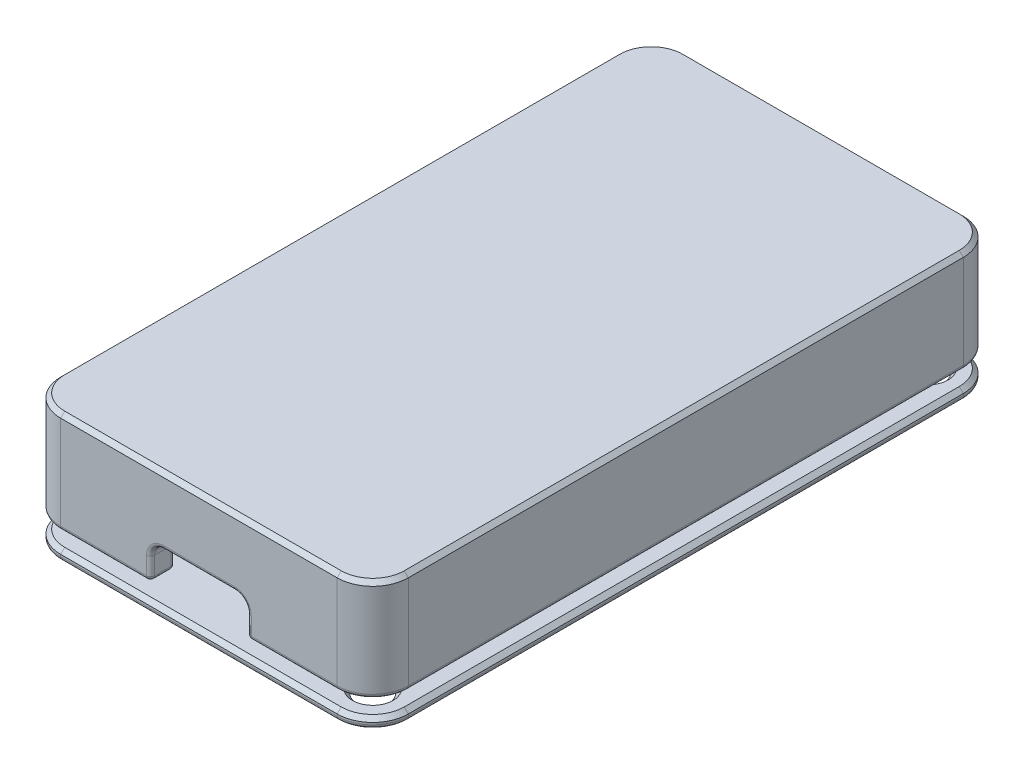
from build123d import *

# Parameters (mm, degrees)
BOSS_EXTRUDE1_DEPTH = 1
SKETCH2_W           = 29.4
SKETCH2_H           = 56.8
BOSS_EXTRUDE2_DEPTH = 9
BOSS_EXTRUDE3_START = -10
BOSS_EXTRUDE3_DEPTH = 1.6
BOSS_EXTRUDE5_DEPTH = 8.4
BOSS_EXTRUDE4_START = 8.4
SKETCH4_W           = 3.6
SKETCH4_H           = 3.6
BOSS_EXTRUDE4_DEPTH = 1
CUT_EXTRUDE1_DEPTH  = 10
SKETCH7_R           = 2
CUT_EXTRUDE2_DEPTH  = 6.7
SKETCH8_R           = 1.6
CUT_EXTRUDE4_DEPTH  = 37.620349534
CHAMFER1_SIZE       = 0.4
CHAMFER2_SIZE       = 0.4
FILLET1_R           = 0.4
FILLET2_R           = 0.4


# Read off the part's stored shape, not the designer's step: Boss-Extrude5
with BuildPart() as part:
    # Sketch1 → Boss-Extrude1 (new body)
    with BuildSketch(Plane(origin=(0, 0, 0), x_dir=(1, 0, 0), z_dir=(0, 1, 0))):
        with BuildLine():
            Line((14.7, 28.4), (14.7, -28.4))
            Line((14.7, -28.4), (-14.7, -28.4))
            Line((-14.7, -28.4), (-14.7, 28.4))
            Line((-14.7, 28.4), (-6.8, 28.4))
            Line((-6.8, 28.4), (-6.8, 30.8))
            Line((-6.8, 30.8), (-13.6, 30.8))
            ThreePointArc((-13.6, 30.8), (-16.074873734, 29.774873734), (-17.1, 27.3))
            Line((-17.1, 27.3), (-17.1, -27.3))
            ThreePointArc((-17.1, -27.3), (-16.074873734, -29.774873734), (-13.6, -30.8))
            Line((-13.6, -30.8), (13.6, -30.8))
            ThreePointArc((13.6, -30.8), (16.074873734, -29.774873734), (17.1, -27.3))
            Line((17.1, -27.3), (17.1, 27.3))
            ThreePointArc((17.1, 27.3), (16.074873734, 29.774873734), (13.6, 30.8))
            Line((13.6, 30.8), (6.8, 30.8))
            Line((6.8, 30.8), (6.8, 28.4))
            Line((6.8, 28.4), (14.7, 28.4))
        make_face()
    extrude(amount=BOSS_EXTRUDE1_DEPTH)

    # Sketch2 → Boss-Extrude2 (add)
    with BuildSketch(Plane(origin=(0, 1, 0), x_dir=(1, 0, 0), z_dir=(0, 1, 0))):
        with BuildLine():
            ThreePointArc((-13.6, 30.8), (-16.074873734, 29.774873734), (-17.1, 27.3))
            Line((-17.1, 27.3), (-17.1, -27.3))
            ThreePointArc((-17.1, -27.3), (-16.074873734, -29.774873734), (-13.6, -30.8))
            Line((-13.6, -30.8), (13.6, -30.8))
            ThreePointArc((13.6, -30.8), (16.074873734, -29.774873734), (17.1, -27.3))
            Line((17.1, -27.3), (17.1, 27.3))
            ThreePointArc((17.1, 27.3), (16.074873734, 29.774873734), (13.6, 30.8))
            Line((13.6, 30.8), (-13.6, 30.8))
        make_face()
        Rectangle(SKETCH2_W, SKETCH2_H, mode=Mode.SUBTRACT)
    extrude(amount=BOSS_EXTRUDE2_DEPTH)

    # Sketch3 → Boss-Extrude3 (add)
    with BuildSketch(Plane.XZ.offset(BOSS_EXTRUDE3_START)):
        with BuildLine():
            Line((13.6, 30.8), (-13.6, 30.8))
            ThreePointArc((-13.6, 30.8), (-16.074873734, 29.774873734), (-17.1, 27.3))
            Line((-17.1, 27.3), (-17.1, -27.3))
            ThreePointArc((-17.1, -27.3), (-16.074873734, -29.774873734), (-13.6, -30.8))
            Line((-13.6, -30.8), (13.6, -30.8))
            ThreePointArc((13.6, -30.8), (16.074873734, -29.774873734), (17.1, -27.3))
            Line((17.1, -27.3), (17.1, 27.3))
            ThreePointArc((17.1, 27.3), (16.074873734, 29.774873734), (13.6, 30.8))
        make_face()
    extrude(amount=BOSS_EXTRUDE3_DEPTH)

    # Boss-Extrude5 outline → Boss-Extrude5 (add)
    with BuildSketch(Plane.XZ.offset(-8.4)):
        with BuildLine():
            ThreePointArc((-13.6, -3.6), (-10, 0), (-13.6, 3.6))
            Line((-13.6, 3.6), (-14.7, 3.6))
            Line((-14.7, 3.6), (-14.7, -3.6))
            Line((-14.7, -3.6), (-13.6, -3.6))
        make_face()
        with BuildLine():
            Line((14.7, 28.4), (10, 28.4))
            Line((10, 28.4), (10, 27.3))
            ThreePointArc((10, 27.3), (11.054415588, 24.754415588), (13.6, 23.7))
            Line((13.6, 23.7), (14.7, 23.7))
            Line((14.7, 23.7), (14.7, 28.4))
        make_face()
        with BuildLine():
            Line((10, -27.3), (10, -28.4))
            Line((10, -28.4), (14.7, -28.4))
            Line((14.7, -28.4), (14.7, -23.7))
            Line((14.7, -23.7), (13.6, -23.7))
            ThreePointArc((13.6, -23.7), (11.054415588, -24.754415588), (10, -27.3))
        make_face()
    extrude(amount=BOSS_EXTRUDE5_DEPTH)

    # Sketch5 → Cut-Extrude1 (cut)
    with BuildSketch(Plane.XY.offset(30.8)):
        with BuildLine():
            Line((-3.5, 3.4), (3.5, 3.4))
            ThreePointArc((3.5, 3.4), (4.383883476, 3.033883476), (4.75, 2.15))
            Line((4.75, 2.15), (4.75, 0))
            Line((4.75, 0), (-4.75, 0))
            Line((-4.75, 0), (-4.75, 2.15))
            ThreePointArc((-4.75, 2.15), (-4.383883476, 3.033883476), (-3.5, 3.4))
        make_face()
    extrude(amount=-CUT_EXTRUDE1_DEPTH, mode=Mode.SUBTRACT)

    # Sketch7 → Cut-Extrude2 (cut)
    with BuildSketch(Plane.XZ):
        with Locations(Location((-13.6, 0, 0), (0, 0, 270))):
            Circle(SKETCH7_R)
        with Locations(Location((13.6, -27.3, 0), (0, 0, 270))):
            Circle(SKETCH7_R)
        with Locations(Location((13.6, 27.3, 0), (0, 0, 270))):
            Circle(SKETCH7_R)
    extrude(amount=-CUT_EXTRUDE2_DEPTH, mode=Mode.SUBTRACT)

    # Chamfer1
    chamfer1_edges = [part.edges().sort_by_distance(p)[0] for p in [
        (0, 10, 30.8),
        (16.074873734, 10, 29.774873734),
        (17.1, 10, 0),
        (16.074873734, 10, -29.774873734),
        (0, 10, -30.8),
        (-16.074873734, 10, -29.774873734),
        (-17.1, 10, 0),
        (-16.074873734, 10, 29.774873734),
    ]]
    chamfer(chamfer1_edges, length=CHAMFER1_SIZE)

    # Fillet2
    fillet2_edges = [part.edges().sort_by_distance(p)[0] for p in [
        (-14.7, 4.2, -28.4),
        (-14.7, 4.2, 28.4),
        (-2.35, 8.4, 28.4),
        (-14.7, 8.4, 16),
        (-2.35, 8.4, -28.4),
        (-14.7, 8.4, -16),
        (-14.7, 0, -16),
        (-10, 0, 0),
        (-10, 8.4, 0),
        (-14.15, 0, 3.6),
        (-14.15, 8.4, 3.6),
        (-14.7, 4.2, 3.6),
        (-14.7, 4.2, -3.6),
        (-14.15, 8.4, -3.6),
        (-14.15, 0, -3.6),
        (14.7, 0, 0),
        (14.7, 8.4, 0),
        (10, 8.4, 27.85),
        (14.7, 4.2, 23.7),
        (14.15, 0, 23.7),
        (14.15, 8.4, 23.7),
        (11.054415588, 0, 24.754415588),
        (11.054415588, 8.4, 24.754415588),
        (10, 4.2, 28.4),
        (10, 0, 27.85),
        (-9.175, 0, 30.8),
        (14.15, 8.4, -23.7),
        (10, 4.2, -28.4),
        (10, 0, -27.85),
        (10, 8.4, -27.85),
        (11.054415588, 0, -24.754415588),
        (11.054415588, 8.4, -24.754415588),
        (-16.074873734, 0, 29.774873734),
        (14.7, 4.2, -23.7),
        (14.15, 0, -23.7),
        (-17.1, 0, 0),
        (-16.074873734, 0, -29.774873734),
        (9.175, 0, 30.8),
        (7.375, 0, 28.4),
        (-4.75, 0, 29.6),
        (-10.2, 0, -30.8),
        (4.75, 0, 29.6),
        (-6.8, 0, -29.6),
        (-4.383883476, 3.033883476, 28.4),
        (0, 3.4, 28.4),
        (4.383883476, 3.033883476, 28.4),
        (4.75, 1.075, 28.4),
        (-4.75, 1.075, 28.4),
        (4.75, 1.075, 30.8),
        (-10.75, 0, -28.4),
        (4.383883476, 3.033883476, 30.8),
        (0, 3.4, 30.8),
        (-4.383883476, 3.033883476, 30.8),
        (-4.75, 1.075, 30.8),
        (-14.7, 0, 16),
        (-9.725, 0, 28.4),
        (8.4, 0, -28.4),
        (-13.6, 0, 2),
        (13.6, 0, -25.3),
        (13.6, 0, 29.3),
        (6.8, 0, -29.6),
        (10.2, 0, -30.8),
        (16.074873734, 0, -29.774873734),
        (17.1, 0, 0),
        (16.074873734, 0, 29.774873734),
        (-6.8, 0.5, -30.8),
        (-6.8, 0.5, -28.4),
        (6.8, 0.5, -28.4),
        (6.8, 0.5, -30.8),
        (0, 1, -28.4),
        (0, 1, -30.8),
    ]]
    fillet(fillet2_edges, radius=FILLET2_R)


with BuildPart() as body_2:
    # Sketch4 → Boss-Extrude4 (new body)
    # profile 1 of 2: a face of its own
    with BuildSketch(Plane.XZ.offset(-8.4).offset(BOSS_EXTRUDE4_START)):
        with BuildLine():
            Line((-13.6, -30.8), (13.6, -30.8))
            ThreePointArc((13.6, -30.8), (16.074873734, -29.774873734), (17.1, -27.3))
            Line((17.1, -27.3), (17.1, 27.3))
            ThreePointArc((17.1, 27.3), (16.074873734, 29.774873734), (13.6, 30.8))
            Line((13.6, 30.8), (-13.6, 30.8))
            ThreePointArc((-13.6, 30.8), (-16.074873734, 29.774873734), (-17.1, 27.3))
            Line((-17.1, 27.3), (-17.1, -27.3))
            ThreePointArc((-17.1, -27.3), (-16.074873734, -29.774873734), (-13.6, -30.8))
        make_face()
        with BuildLine():
            Line((10, -28.4), (10, -27.3))
            ThreePointArc((10, -27.3), (11.054415588, -24.754415588), (13.6, -23.7))
            Line((13.6, -23.7), (14.7, -23.7))
            Line((14.7, -23.7), (14.7, 23.7))
            Line((14.7, 23.7), (13.6, 23.7))
            ThreePointArc((13.6, 23.7), (11.054415588, 24.754415588), (10, 27.3))
            Line((10, 27.3), (10, 28.4))
            Line((10, 28.4), (-14.7, 28.4))
            Line((-14.7, 28.4), (-14.7, 3.6))
            Line((-14.7, 3.6), (-13.6, 3.6))
            ThreePointArc((-13.6, 3.6), (-10, 0), (-13.6, -3.6))
            Line((-13.6, -3.6), (-14.7, -3.6))
            Line((-14.7, -3.6), (-14.7, -28.4))
            Line((-14.7, -28.4), (10, -28.4))
        make_face(mode=Mode.SUBTRACT)
    # profile 2 of 2: a face of its own
    with BuildSketch(Plane.XZ.offset(-8.4).offset(BOSS_EXTRUDE4_START)):
        with BuildLine():
            Line((-14.7, -28.4), (10, -28.4))
            Line((10, -28.4), (10, -27.3))
            ThreePointArc((10, -27.3), (11.054415588, -24.754415588), (13.6, -23.7))
            Line((13.6, -23.7), (14.7, -23.7))
            Line((14.7, -23.7), (14.7, 23.7))
            Line((14.7, 23.7), (13.6, 23.7))
            ThreePointArc((13.6, 23.7), (11.054415588, 24.754415588), (10, 27.3))
            Line((10, 27.3), (10, 28.4))
            Line((10, 28.4), (-14.7, 28.4))
            Line((-14.7, 28.4), (-14.7, 3.6))
            Line((-14.7, 3.6), (-13.6, 3.6))
            ThreePointArc((-13.6, 3.6), (-10, 0), (-13.6, -3.6))
            Line((-13.6, -3.6), (-14.7, -3.6))
            Line((-14.7, -3.6), (-14.7, -28.4))
        make_face()
        with Locations((0, 8.3)):
            Rectangle(SKETCH4_W, SKETCH4_H, mode=Mode.SUBTRACT)
        with Locations((0, -1.7)):
            Rectangle(SKETCH4_W, SKETCH4_H, mode=Mode.SUBTRACT)
        with Locations((0, -11.7)):
            Rectangle(SKETCH4_W, SKETCH4_H, mode=Mode.SUBTRACT)
    extrude(amount=BOSS_EXTRUDE4_DEPTH)


with BuildPart() as body_2_1:
    # Move Body 1: moved
    add(body_2.part.moved(Location((0, -1.6, 0))))

    # Sketch8 → Cut-Extrude4 (cut, through all)
    with BuildSketch(Plane.XZ):
        with Locations(Location((-13.6, 0, 0), (0, 0, 90))):
            Circle(SKETCH8_R)
        with Locations(Location((13.6, 27.3, 0), (0, 0, 90))):
            Circle(SKETCH8_R)
        with Locations(Location((13.6, -27.3, 0), (0, 0, 90))):
            Circle(SKETCH8_R)
    extrude(amount=CUT_EXTRUDE4_DEPTH, mode=Mode.SUBTRACT)

    # Chamfer2
    chamfer2_edges = [body_2_1.edges().sort_by_distance(p)[0] for p in [
        (-13.6, -1.6, -1.6),
        (13.6, -1.6, 25.7),
        (13.6, -1.6, -28.9),
        (0, -1.6, -30.8),
        (16.074873734, -1.6, -29.774873734),
        (17.1, -1.6, 0),
        (16.074873734, -1.6, 29.774873734),
        (0, -1.6, 30.8),
        (-16.074873734, -1.6, 29.774873734),
        (-17.1, -1.6, 0),
        (-16.074873734, -1.6, -29.774873734),
        (-1.8, -1.6, -11.7),
        (0, -1.6, -13.5),
        (0, -1.6, -9.9),
        (1.8, -1.6, -11.7),
        (-1.8, -1.6, -1.7),
        (0, -1.6, -3.5),
        (0, -1.6, 0.1),
        (1.8, -1.6, -1.7),
        (-1.8, -1.6, 8.3),
        (0, -1.6, 6.5),
        (0, -1.6, 10.1),
        (1.8, -1.6, 8.3),
    ]]
    chamfer(chamfer2_edges, length=CHAMFER2_SIZE)

    # Fillet1
    fillet1_edges = [body_2_1.edges().sort_by_distance(p)[0] for p in [
        (-13.6, -2.6, -1.6),
        (13.6, -2.6, 25.7),
        (13.6, -2.6, -28.9),
        (-17.1, -2.6, 0),
        (-16.074873734, -2.6, 29.774873734),
        (0, -2.6, 30.8),
        (1.8, -2.6, -11.7),
        (0, -2.6, -9.9),
        (-1.8, -2.6, -11.7),
        (16.074873734, -2.6, 29.774873734),
        (0, -2.6, -13.5),
        (17.1, -2.6, 0),
        (16.074873734, -2.6, -29.774873734),
        (1.8, -2.6, -1.7),
        (0, -2.6, 0.1),
        (-1.8, -2.6, -1.7),
        (-16.074873734, -2.6, -29.774873734),
        (0, -2.6, -3.5),
        (0, -2.6, -30.8),
        (1.8, -2.6, 8.3),
        (0, -2.6, 10.1),
        (-1.8, -2.6, 8.3),
        (0, -2.6, 6.5),
    ]]
    fillet(fillet1_edges, radius=FILLET1_R)


solid = Compound([part.part, body_2_1.part])
